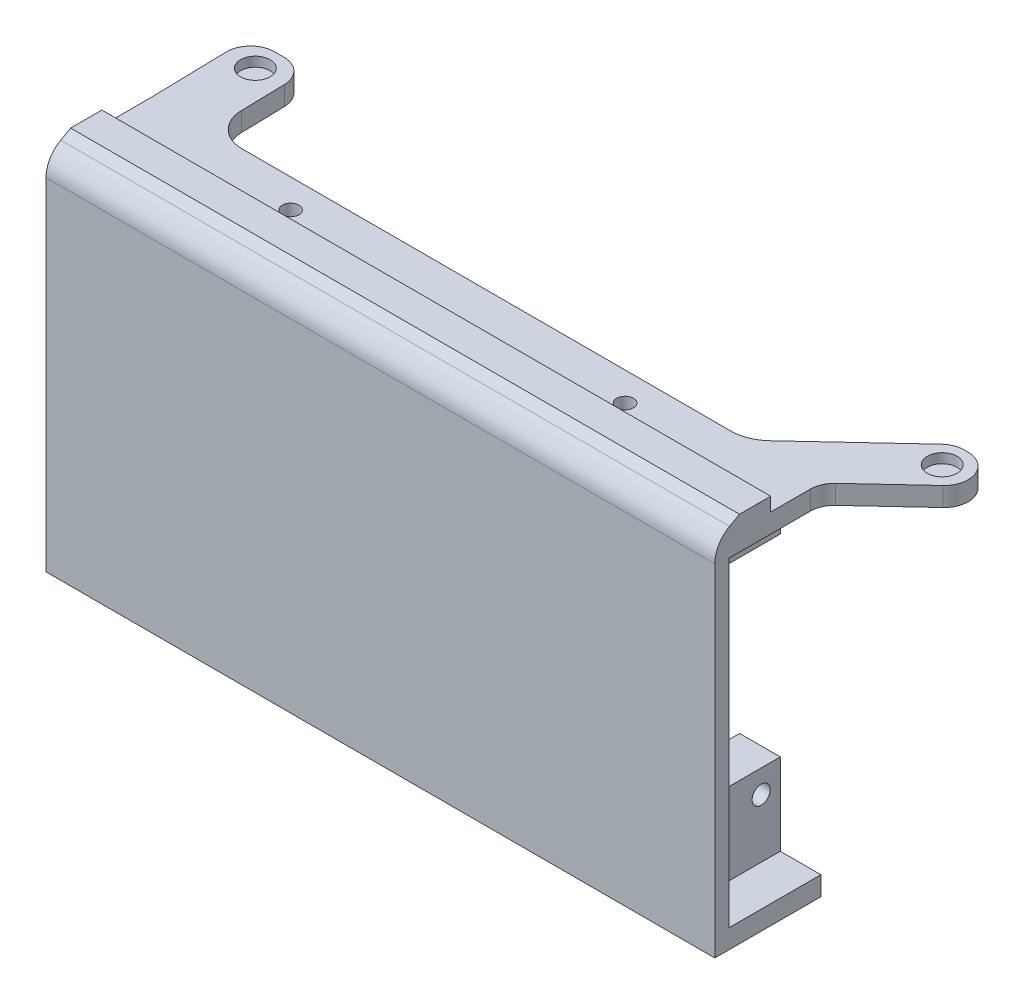
from build123d import *
from OCP.BRepFilletAPI import BRepFilletAPI_MakeChamfer

# Parameters (mm, degrees)
SKETCH1_W                     = 140
SKETCH1_H                     = 75
BOSS_EXTRUDE1_DEPTH           = 22.2
CUT_EXTRUDE1_DEPTH            = 19.2
CUT_EXTRUDE2_DEPTH            = 147.625679879
CUT_EXTRUDE2_DEPTH_BACK       = 147.625679879
SKETCH3_R                     = 1.9
SKETCH3_R_2                   = 1.911475776
SKETCH4_R                     = 6.5
BOSS_EXTRUDE2_DEPTH           = 14
BOSS_EXTRUDE2_DRAFT           = 5
BOSS_EXTRUDE2_PROFILE_2_DEPTH = 14
BOSS_EXTRUDE2_PROFILE_2_DRAFT = 5
BOSS_EXTRUDE2_PROFILE_3_DEPTH = 14
BOSS_EXTRUDE2_PROFILE_3_DRAFT = 5
BOSS_EXTRUDE2_PROFILE_4_DEPTH = 14
BOSS_EXTRUDE2_PROFILE_4_DRAFT = 5
CUT_EXTRUDE11_DEPTH           = 40
CUT_EXTRUDE11_DEPTH_BACK      = 40
SKETCH5_R                     = 1.4
CUT_EXTRUDE3_DEPTH            = 6
SKETCH25_W                    = 70.133665618
SKETCH25_H                    = 40.31111142
SKETCH25_W_2                  = 62.5
SKETCH25_H_2                  = 36.963012465
CUT_EXTRUDE12_DEPTH           = 82.7
CUT_EXTRUDE5_DEPTH            = 103.146169776
CUT_EXTRUDE5_DEPTH_BACK       = 103.146169776
SKETCH9_R                     = 1.75
BOSS_EXTRUDE5_DEPTH           = 4
FILLET4_R                     = 5
SKETCH13_R                    = 3.1
CUT_EXTRUDE7_DEPTH            = 2
BOSS_EXTRUDE6_DEPTH           = 140
FILLET5_R                     = 6
SKETCH23_R                    = 3.5
SKETCH23_R_2                  = 1.75
BOSS_EXTRUDE13_DEPTH          = 1.5
FILLET7_R                     = 3
CHAMFER2_SIZE                 = 1
CHAMFER2_SIZE_2               = 1.5


# Some blends are built 0.0001 mm under size
with BuildPart() as part:
    # Sketch1 → Boss-Extrude1 (new body)
    with BuildSketch(Plane.XY):
        Rectangle(SKETCH1_W, SKETCH1_H)
    extrude(amount=BOSS_EXTRUDE1_DEPTH)

    # Sketch2 → Cut-Extrude1 (cut)
    with BuildSketch(Plane(origin=(0, 0, 0), x_dir=(-1, 0, 0), z_dir=(0, 0, -1))):
        Polygon((-61.5, 24), (-53, 24), (-53, 33.5), (53, 33.5), (53, 24), (61.5, 24), (61.5, 33.5), (70, 33.5), (70, 20.2), (70, -20.2), (70, -33.5), (61.5, -33.5), (61.5, -16.4), (53, -16.4), (53, -33.5), (-53, -33.5), (-53, -16.4), (-61.5, -16.4), (-61.5, -33.5), (-70, -33.5), (-70, -20.2), (-70, 20.2), (-70, 33.5), (-61.5, 33.5), align=None)
    extrude(amount=-CUT_EXTRUDE1_DEPTH, mode=Mode.SUBTRACT)

    # Sketch3 → Cut-Extrude2 (cut, two sides: drawn at the far end of the back side and taken through both)
    with BuildSketch(Plane.ZY.offset(70).offset(-CUT_EXTRUDE2_DEPTH_BACK)):
        with Locations((14, 28.25)):
            Circle(SKETCH3_R)
        with Locations((4, 28.25)):
            Circle(SKETCH3_R)
        with Locations((4, -21.25)):
            Circle(SKETCH3_R)
        with Locations((14, -21.25)):
            Circle(SKETCH3_R_2)
    extrude(amount=CUT_EXTRUDE2_DEPTH + CUT_EXTRUDE2_DEPTH_BACK, mode=Mode.SUBTRACT)


with BuildPart() as boss_extrude2_tool:
    # Sketch4 → Boss-Extrude2 (with draft: the straight prism first)
    with BuildSketch(Plane(origin=(0, 0, 19.2), x_dir=(-1, 0, 0), z_dir=(0, 0, -1))):
        with Locations((-28, -3.5)):
            Circle(SKETCH4_R)
    extrude(amount=BOSS_EXTRUDE2_DEPTH)
    # Boss-Extrude2: the draft: its side faces are tilted about the plane it starts from
    boss_extrude2_sides = [boss_extrude2_tool.faces().sort_by_distance(p)[0] for p in [
        (34.5, -3.5, 12.2),
    ]]
    draft(boss_extrude2_sides, Plane(origin=(0, 0, 19.2), x_dir=(-1, 0, 0), z_dir=(0, 0, -1)), BOSS_EXTRUDE2_DRAFT)


with BuildPart() as part_1:
    add(part.part)

    # Boss-Extrude2: add boss_extrude2_tool
    add(boss_extrude2_tool.part)


with BuildPart() as boss_extrude2_profile_2_tool:
    # Sketch4 → Boss-Extrude2 profile 2 (with draft: the straight prism first)
    with BuildSketch(Plane(origin=(0, 0, 19.2), x_dir=(-1, 0, 0), z_dir=(0, 0, -1))):
        with Locations((28, -3.5)):
            Circle(SKETCH4_R)
    extrude(amount=BOSS_EXTRUDE2_PROFILE_2_DEPTH)
    # Boss-Extrude2 profile 2: the draft: its side faces are tilted about the plane it starts from
    boss_extrude2_profile_2_sides = [boss_extrude2_profile_2_tool.faces().sort_by_distance(p)[0] for p in [
        (-21.5, -3.5, 12.2),
    ]]
    draft(boss_extrude2_profile_2_sides, Plane(origin=(0, 0, 19.2), x_dir=(-1, 0, 0), z_dir=(0, 0, -1)), BOSS_EXTRUDE2_PROFILE_2_DRAFT)


with BuildPart() as part_2:
    add(part_1.part)

    # Boss-Extrude2 profile 2: add boss_extrude2_profile_2_tool
    add(boss_extrude2_profile_2_tool.part)


with BuildPart() as boss_extrude2_profile_3_tool:
    # Sketch4 → Boss-Extrude2 profile 3 (with draft: the straight prism first)
    with BuildSketch(Plane(origin=(0, 0, 19.2), x_dir=(-1, 0, 0), z_dir=(0, 0, -1))):
        with Locations((28, -21.5)):
            Circle(SKETCH4_R)
    extrude(amount=BOSS_EXTRUDE2_PROFILE_3_DEPTH)
    # Boss-Extrude2 profile 3: the draft: its side faces are tilted about the plane it starts from
    boss_extrude2_profile_3_sides = [boss_extrude2_profile_3_tool.faces().sort_by_distance(p)[0] for p in [
        (-21.5, -21.5, 12.2),
    ]]
    draft(boss_extrude2_profile_3_sides, Plane(origin=(0, 0, 19.2), x_dir=(-1, 0, 0), z_dir=(0, 0, -1)), BOSS_EXTRUDE2_PROFILE_3_DRAFT)


with BuildPart() as part_3:
    add(part_2.part)

    # Boss-Extrude2 profile 3: add boss_extrude2_profile_3_tool
    add(boss_extrude2_profile_3_tool.part)


with BuildPart() as boss_extrude2_profile_4_tool:
    # Sketch4 → Boss-Extrude2 profile 4 (with draft: the straight prism first)
    with BuildSketch(Plane(origin=(0, 0, 19.2), x_dir=(-1, 0, 0), z_dir=(0, 0, -1))):
        with Locations((-28, -21.5)):
            Circle(SKETCH4_R)
    extrude(amount=BOSS_EXTRUDE2_PROFILE_4_DEPTH)
    # Boss-Extrude2 profile 4: the draft: its side faces are tilted about the plane it starts from
    boss_extrude2_profile_4_sides = [boss_extrude2_profile_4_tool.faces().sort_by_distance(p)[0] for p in [
        (34.5, -21.5, 12.2),
    ]]
    draft(boss_extrude2_profile_4_sides, Plane(origin=(0, 0, 19.2), x_dir=(-1, 0, 0), z_dir=(0, 0, -1)), BOSS_EXTRUDE2_PROFILE_4_DRAFT)


with BuildPart() as part_4:
    add(part_3.part)

    # Boss-Extrude2 profile 4: add boss_extrude2_profile_4_tool
    add(boss_extrude2_profile_4_tool.part)

    # Sketch24 → Cut-Extrude11 (cut, two sides: drawn at the far end of the back side and taken through both)
    with BuildSketch(Plane(origin=(0, 0, 0), x_dir=(0, 0, -1), z_dir=(1, 0, 0)).offset(-CUT_EXTRUDE11_DEPTH_BACK)):
        Polygon((-5.2, -26.775158711), (-15.30939651, 8.480496697), (-1.271015088, 8.297193518), align=None)
    extrude(amount=CUT_EXTRUDE11_DEPTH + CUT_EXTRUDE11_DEPTH_BACK, mode=Mode.SUBTRACT)

    # Sketch5 → Cut-Extrude3 (cut)
    with BuildSketch(Plane(origin=(0, -1.242031303, 12.521506468), x_dir=(-1, 0, 0), z_dir=(0, 0.2756373558169999, -0.9612616959383188))):
        with Locations(Location((-28.00221613, -1.596940855, 0), (0, 0, 90))):
            Circle(SKETCH5_R)
        with Locations(Location((27.99778387, -1.596940855, 0), (0, 0, 90))):
            Circle(SKETCH5_R)
        with Locations(Location((27.99778387, -20.596940855, 0), (0, 0, 90))):
            Circle(SKETCH5_R)
        with Locations(Location((-28.00221613, -20.596940855, 0), (0, 0, 90))):
            Circle(SKETCH5_R)
    extrude(amount=-CUT_EXTRUDE3_DEPTH, mode=Mode.SUBTRACT)

    # Sketch25 → Cut-Extrude12 (cut, through all)
    with BuildSketch(Plane(origin=(0, 0, 19.2), x_dir=(-1, 0, 0), z_dir=(0, 0, -1))):
        with Locations((0, -10.591289387)):
            Rectangle(SKETCH25_W, SKETCH25_H)
        with Locations((0, -10.591289386)):
            Rectangle(SKETCH25_W_2, SKETCH25_H_2, mode=Mode.SUBTRACT)
    extrude(amount=CUT_EXTRUDE12_DEPTH, mode=Mode.SUBTRACT)

    # Sketch9 → Cut-Extrude5 (cut, two sides: drawn at the far end of the back side and taken through both)
    with BuildSketch(Plane(origin=(0, -33.5, 0), x_dir=(1, 0, 0), z_dir=(0, 1, 0)).offset(-CUT_EXTRUDE5_DEPTH_BACK)):
        with Locations(Location((35, -6, 0), (0, 0, 270))):
            Circle(SKETCH9_R)
        with Locations(Location((-35, -6, 0), (0, 0, 90))):
            Circle(SKETCH9_R)
    extrude(amount=CUT_EXTRUDE5_DEPTH + CUT_EXTRUDE5_DEPTH_BACK, mode=Mode.SUBTRACT)

    # Sketch12 → Boss-Extrude5 (add)
    with BuildSketch(Plane(origin=(0, 37.5, 0), x_dir=(1, 0, 0), z_dir=(0, 1, 0))):
        with BuildLine():
            Line((70, 0), (92.519742911, 21))
            Line((92.519742911, 21), (77.019742911, 21))
            Line((77.019742911, 21), (56.991351823, 2.32322316))
            ThreePointArc((56.991351823, 2.32322316), (54.262967879, 0.601741094), (51.093506237, 0))
            Line((51.093506237, 0), (58.093506237, 0))
            Line((58.093506237, 0), (70, 0))
        make_face()
        with BuildLine():
            Line((-70, 0), (-70.5, 21))
            Line((-70.5, 21), (-58.5, 21))
            Line((-58.5, 21), (-58.162699537, 6.833380554))
            ThreePointArc((-58.162699537, 6.833380554), (-56.055166635, 1.991690099), (-51.164682821, 0))
            Line((-51.164682821, 0), (-70, 0))
        make_face()
    extrude(amount=-BOSS_EXTRUDE5_DEPTH)

    # Fillet4
    fillet4_edges = [part_4.edges().sort_by_distance(p)[0] for p in [
        (70, 35.5, 0),
        (77.019742911, 35.5, -21),
        (92.519742911, 35.5, -21),
        (-70.5, 35.5, -21),
        (-58.5, 35.5, -21),
    ]]
    fillet(fillet4_edges, radius=FILLET4_R)

    # Sketch13 → Cut-Extrude7 (cut)
    with BuildSketch(Plane(origin=(0, 37.5, 0), x_dir=(1, 0, 0), z_dir=(0, 1, 0))):
        with Locations(Location((79.386619677, 16, 0), (0, 0, 270))):
            Circle(SKETCH13_R)
        with Locations(Location((-64.379251942, 16, 0), (0, 0, 270))):
            Circle(SKETCH13_R)
    extrude(amount=-CUT_EXTRUDE7_DEPTH, mode=Mode.SUBTRACT)

    # Sketch14 → Boss-Extrude6 (add)
    with BuildSketch(Plane(origin=(70, 0, 0), x_dir=(0, 0, -1), z_dir=(1, 0, 0))):
        Polygon((-22.2, 37.5), (-16.602, 37.5), (-10.5, 37.5), (-10.5, 40.365053008), (-17.042904586, 40.365053008), align=None)
    extrude(amount=-BOSS_EXTRUDE6_DEPTH)

    # Fillet5
    fillet5_edges = [part_4.edges().sort_by_distance(p)[0] for p in [
        (0, 37.5, 22.2),
    ]]
    fillet(fillet5_edges, radius=FILLET5_R)

    # Sketch23 → Boss-Extrude13 (add)
    # profile 1 of 2: a face of its own
    with BuildSketch(Plane(origin=(0, -33.5, 0), x_dir=(1, 0, 0), z_dir=(0, 1, 0))):
        with Locations(Location((-35, -6, 0), (0, 0, 90))):
            Circle(SKETCH23_R)
        with Locations(Location((-35, -6, 0), (0, 0, 270))):
            Circle(SKETCH23_R_2, mode=Mode.SUBTRACT)
    # profile 2 of 2: a face of its own
    with BuildSketch(Plane(origin=(0, -33.5, 0), x_dir=(1, 0, 0), z_dir=(0, 1, 0))):
        with Locations(Location((35, -6, 0), (0, 0, 90))):
            Circle(SKETCH23_R)
        with Locations(Location((35, -6, 0), (0, 0, 270))):
            Circle(SKETCH23_R_2, mode=Mode.SUBTRACT)
    extrude(amount=BOSS_EXTRUDE13_DEPTH)

    # Fillet7
    # the kernel refuses this fillet: 3 mm, written as the material it adds along each edge
    with BuildSketch(Plane(origin=(28, -21.5, 19.2), x_dir=(0.9999950652018581, 0.0031415874858791, 0), z_dir=(0.0031415874858791, -0.9999950652018581, 0))) as fillet7_piece_1_section:
        with BuildLine():
            CenterArc((6.5 + FILLET7_R * 0.916331174017, -FILLET7_R), FILLET7_R, 90, 85)
            Line((6.5 - FILLET7_R * 0.0798635240743, -FILLET7_R * 0.912844257252), (6.5, 0))
            Line((6.5, 0), (6.5 + FILLET7_R * 0.916331174017, 0))
        make_face()
    fillet7_piece_1 = revolve(axis=Axis((28, -21.5, 19.2), (0, 0, 1)), revolution_arc=359.64, mode=Mode.PRIVATE)
    fillet7_piece_1 = split(fillet7_piece_1, bisect_by=Plane(origin=(31.25, -21.5, 18.439892178), z_dir=(-1, 0, 0)), keep=Keep.TOP, mode=Mode.PRIVATE)
    with BuildSketch(Plane(origin=(-28, -21.5, 19.2), x_dir=(-0.9999950652018581, 0.003141587485880193, 0), z_dir=(-0.003141587485880193, -0.9999950652018581, 0))) as fillet7_piece_2_section:
        with BuildLine():
            CenterArc((6.5 + FILLET7_R * 0.916331174017, FILLET7_R), FILLET7_R, 185, 85)
            Line((6.5 - FILLET7_R * 0.0798635240743, FILLET7_R * 0.912844257252), (6.5, 0))
            Line((6.5, 0), (6.5 + FILLET7_R * 0.916331174017, 0))
        make_face()
    fillet7_piece_2 = revolve(axis=Axis((-28, -21.5, 19.2), (0, 0, -1)), revolution_arc=359.64, mode=Mode.PRIVATE)
    fillet7_piece_2 = split(fillet7_piece_2, bisect_by=Plane(origin=(-31.25, -21.5, 18.439892178), z_dir=(1, 0, 0)), keep=Keep.TOP, mode=Mode.PRIVATE)
    with BuildSketch(Plane(origin=(-28, -3.5, 19.2), x_dir=(-0.9999950652018581, 0.003141587485880056, 0), z_dir=(-0.003141587485880056, -0.9999950652018581, 0))) as fillet7_piece_3_section:
        with BuildLine():
            CenterArc((6.5 + FILLET7_R * 0.916331174017, FILLET7_R), FILLET7_R, 185, 85)
            Line((6.5 - FILLET7_R * 0.0798635240743, FILLET7_R * 0.912844257252), (6.5, 0))
            Line((6.5, 0), (6.5 + FILLET7_R * 0.916331174017, 0))
        make_face()
    fillet7_piece_3 = revolve(axis=Axis((-28, -3.5, 19.2), (0, 0, -1)), revolution_arc=359.64, mode=Mode.PRIVATE)
    fillet7_piece_3 = split(fillet7_piece_3, bisect_by=Plane(origin=(-31.25, -3.5, 18.439892178), z_dir=(1, 0, 0)), keep=Keep.TOP, mode=Mode.PRIVATE)
    with BuildSketch(Plane(origin=(28, -3.5, 19.2), x_dir=(0.9999950652018581, 0.0031415874858793697, 0), z_dir=(0.0031415874858793697, -0.9999950652018581, 0))) as fillet7_piece_4_section:
        with BuildLine():
            CenterArc((6.5 + FILLET7_R * 0.916331174017, -FILLET7_R), FILLET7_R, 90, 85)
            Line((6.5 - FILLET7_R * 0.0798635240743, -FILLET7_R * 0.912844257252), (6.5, 0))
            Line((6.5, 0), (6.5 + FILLET7_R * 0.916331174017, 0))
        make_face()
    fillet7_piece_4 = revolve(axis=Axis((28, -3.5, 19.2), (0, 0, 1)), revolution_arc=359.64, mode=Mode.PRIVATE)
    fillet7_piece_4 = split(fillet7_piece_4, bisect_by=Plane(origin=(31.25, -3.5, 18.439892178), z_dir=(-1, 0, 0)), keep=Keep.TOP, mode=Mode.PRIVATE)
    add([fillet7_piece_1, fillet7_piece_2, fillet7_piece_3, fillet7_piece_4])

    # Chamfer2
    chamfer2_edges_1 = [part_4.edges().sort_by_distance(p)[0] for p in [
        (-35, -32, 9.5),
    ]]
    chamfer2_side_1 = [part_4.faces().sort_by_distance(p)[0] for p in [
        (-35, -32, 9.48),
    ]]
    chamfer2_edges_2 = [part_4.edges().sort_by_distance(p)[0] for p in [
        (35, -32, 9.5),
    ]]
    chamfer2_side_2 = [part_4.faces().sort_by_distance(p)[0] for p in [
        (35, -32, 9.48),
    ]]
    chamfer2 = BRepFilletAPI_MakeChamfer(part_4.part.solid().wrapped)
    for e in chamfer2_edges_1:
        chamfer2.Add(CHAMFER2_SIZE - 0.0001, CHAMFER2_SIZE_2 - 0.0001, e.wrapped, chamfer2_side_1[0].wrapped)
    for e in chamfer2_edges_2:
        chamfer2.Add(CHAMFER2_SIZE - 0.0001, CHAMFER2_SIZE_2 - 0.0001, e.wrapped, chamfer2_side_2[0].wrapped)
    add(Compound.cast(chamfer2.Shape()), mode=Mode.REPLACE)  # a hair under: the kernel refuses the full size


solid = part_4.part
